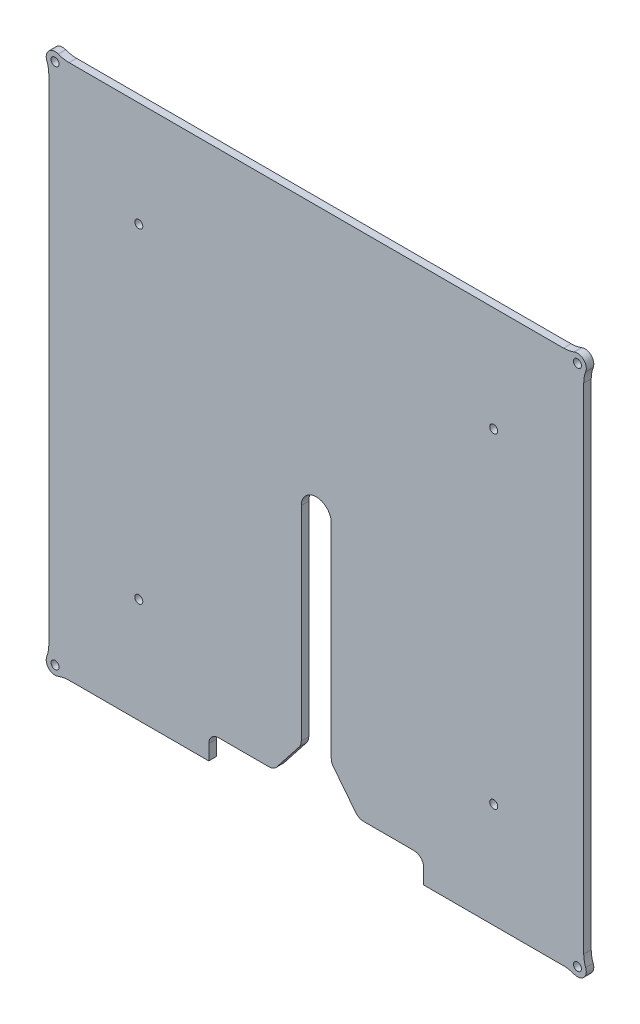
from build123d import *

# Parameters (mm, degrees)
SKETCH1_R           = 1.6
BOSS_EXTRUDE1_DEPTH = 3
CUT_EXTRUDE1_DEPTH  = 153.814767522
CUT_EXTRUDE3_DEPTH  = 153.814767522
FILLET1_R           = 4
SKETCH3_R           = 1.6
CUT_EXTRUDE2_DEPTH  = 153.814767522


with BuildPart() as part:
    # Sketch1 → Boss-Extrude1 (new body)
    with BuildSketch(Plane.XY):
        with BuildLine():
            Line((-107, 98.923010333), (-107, -98.923010333))
            ThreePointArc((-107, -98.923010333), (-107.201661971, -101.11372249), (-107.799869959, -103.230804092))
            ThreePointArc((-107.799869959, -103.230804092), (-107, -107), (-103.230804092, -107.799869959))
            ThreePointArc((-103.230804092, -107.799869959), (-101.11372249, -107.201661971), (-98.923010333, -107))
            Line((-98.923010333, -107), (-43, -107))
            Line((-43, -107), (-43, -101))
            ThreePointArc((-43, -101), (-41.828427125, -98.171572875), (-39, -97))
            Line((-39, -97), (39, -97))
            ThreePointArc((39, -97), (41.828427125, -98.171572875), (43, -101))
            Line((43, -101), (43, -107))
            Line((43, -107), (98.923010333, -107))
            ThreePointArc((98.923010333, -107), (101.11372249, -107.201661971), (103.230804092, -107.799869959))
            ThreePointArc((103.230804092, -107.799869959), (107, -107), (107.799869959, -103.230804092))
            ThreePointArc((107.799869959, -103.230804092), (107.201661971, -101.11372249), (107, -98.923010333))
            Line((107, -98.923010333), (107, 98.923010333))
            ThreePointArc((107, 98.923010333), (107.201661971, 101.11372249), (107.799869959, 103.230804092))
            ThreePointArc((107.799869959, 103.230804092), (107, 107), (103.230804092, 107.799869959))
            ThreePointArc((103.230804092, 107.799869959), (101.11372249, 107.201661971), (98.923010333, 107))
            Line((98.923010333, 107), (-98.923010333, 107))
            ThreePointArc((-98.923010333, 107), (-101.11372249, 107.201661971), (-103.230804092, 107.799869959))
            ThreePointArc((-103.230804092, 107.799869959), (-107, 107), (-107.799869959, 103.230804092))
            ThreePointArc((-107.799869959, 103.230804092), (-107.201661971, 101.11372249), (-107, 98.923010333))
        make_face()
        with Locations((-104.5, -104.5)):
            Circle(SKETCH1_R, mode=Mode.SUBTRACT)
        with Locations((-104.5, 104.5)):
            Circle(SKETCH1_R, mode=Mode.SUBTRACT)
        with Locations((104.5, 104.5)):
            Circle(SKETCH1_R, mode=Mode.SUBTRACT)
        with Locations((104.5, -104.5)):
            Circle(SKETCH1_R, mode=Mode.SUBTRACT)
    extrude(amount=BOSS_EXTRUDE1_DEPTH)

    # Sketch2 → Cut-Extrude1 (cut, through all)
    with BuildSketch(Plane(origin=(0, 0, 0), x_dir=(-1, 0, 0), z_dir=(0, 0, -1))):
        with BuildLine():
            Line((6, -97), (-6, -97))
            Line((-6, -97), (-6, 0))
            ThreePointArc((-6, 0), (0, 6), (6, 0))
            Line((6, 0), (6, -97))
        make_face()
    extrude(amount=-CUT_EXTRUDE1_DEPTH, mode=Mode.SUBTRACT)

    # Sketch4 → Cut-Extrude3 (cut, through all)
    with BuildSketch(Plane.XY.offset(3)):
        Polygon((-17, -97), (17, -97), (6, -83), (-6, -83), align=None)
    extrude(amount=-CUT_EXTRUDE3_DEPTH, mode=Mode.SUBTRACT)

    # Fillet1
    fillet1_edges = [part.edges().sort_by_distance(p)[0] for p in [
        (6, -83, 1.5),
        (-6, -83, 1.5),
        (17, -97, 1.5),
        (-17, -97, 1.5),
    ]]
    fillet(fillet1_edges, radius=FILLET1_R)

    # Sketch3 → Cut-Extrude2 (cut, through all)
    with BuildSketch(Plane.XY.offset(3)):
        with Locations((-71, 65)):
            Circle(SKETCH3_R)
        with Locations((71, 65)):
            Circle(SKETCH3_R)
        with Locations((71, -65)):
            Circle(SKETCH3_R)
        with Locations((-71, -65)):
            Circle(SKETCH3_R)
    extrude(amount=-CUT_EXTRUDE2_DEPTH, mode=Mode.SUBTRACT)


solid = part.part
